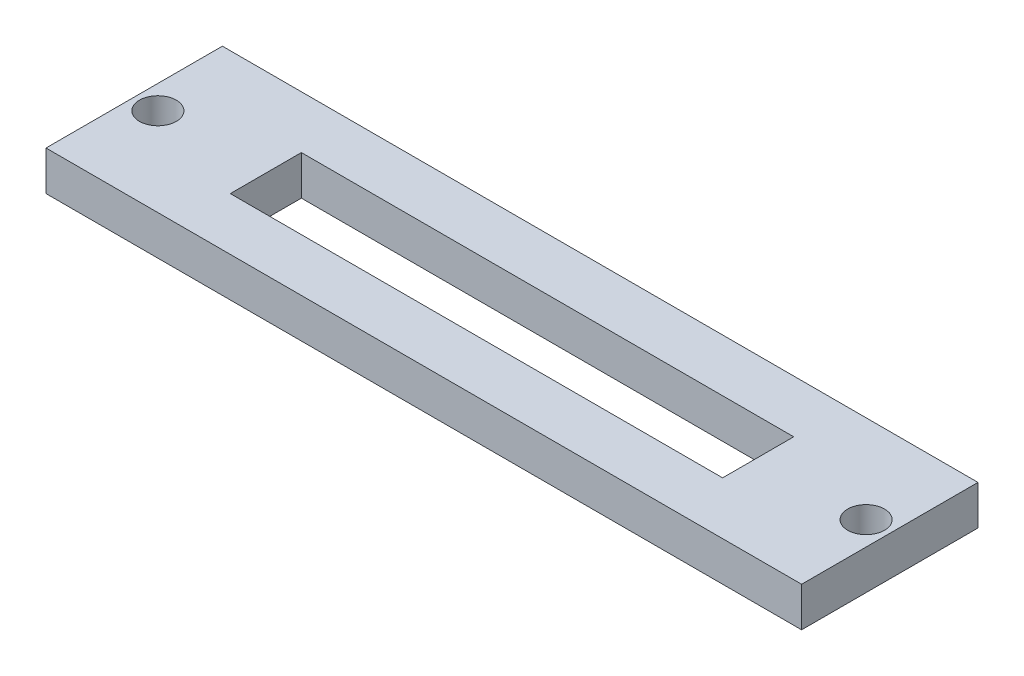
from build123d import *

# Parameters (mm, degrees)
SKETCH1_W           = 57.4
SKETCH1_H           = 13.4
SKETCH1_R           = 1.4
SKETCH1_W_2         = 37.4
SKETCH1_H_2         = 5.4
BOSS_EXTRUDE1_DEPTH = 3


with BuildPart() as part:
    # Sketch1 → Boss-Extrude1 (new body)
    with BuildSketch(Plane(origin=(0, 15, 0), x_dir=(1, 0, 0), z_dir=(0, 1, 0))):
        with Locations((0, 24.6)):
            Rectangle(SKETCH1_W, SKETCH1_H)
        with Locations((-26.9, 24.6)):
            Circle(SKETCH1_R, mode=Mode.SUBTRACT)
        with Locations((26.9, 24.6)):
            Circle(SKETCH1_R, mode=Mode.SUBTRACT)
        with Locations((0, 24.6)):
            Rectangle(SKETCH1_W_2, SKETCH1_H_2, mode=Mode.SUBTRACT)
    extrude(amount=BOSS_EXTRUDE1_DEPTH)


solid = part.part
